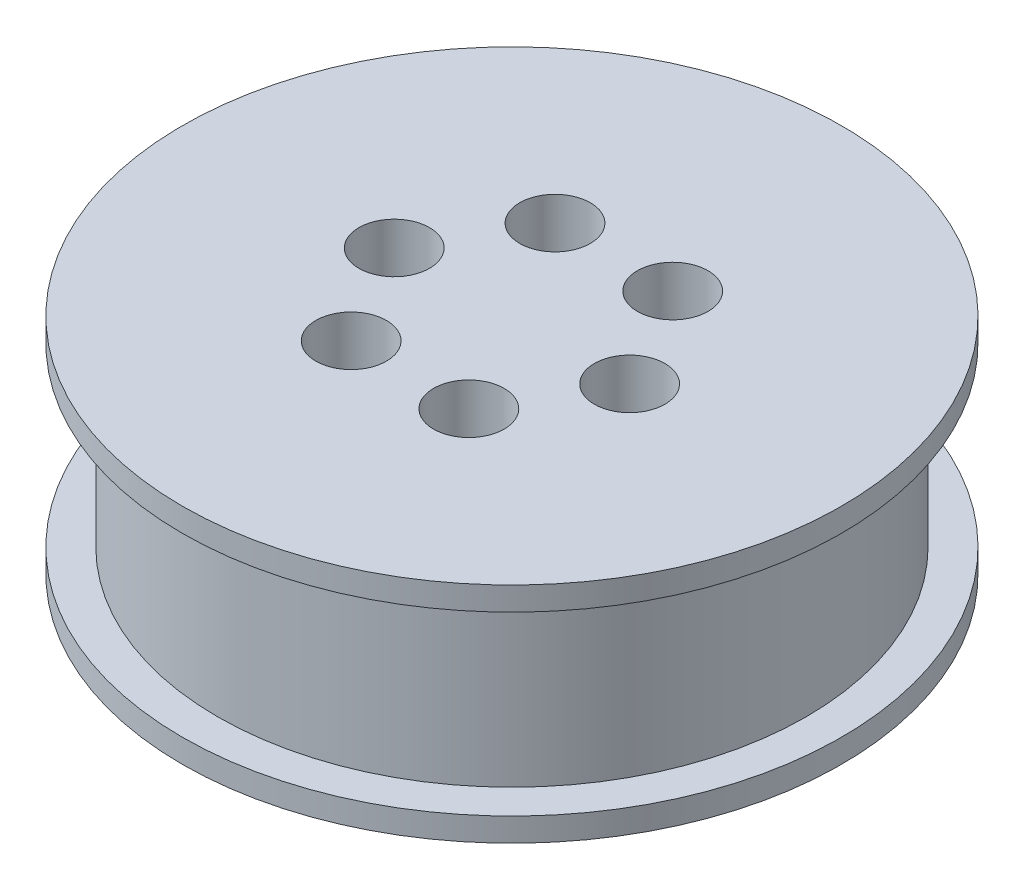
from build123d import *

# Parameters (mm, degrees)
SKETCH1_R           = 25
BOSS_EXTRUDE1_DEPTH = 7.5
SKETCH2_R           = 28
BOSS_EXTRUDE2_DEPTH = 2
SKETCH3_R           = 1.7
CUT_EXTRUDE1_DEPTH  = 44.920382512
SKETCH4_R           = 3
CUT_EXTRUDE2_DEPTH  = 5


with BuildPart() as part:
    # Sketch1 → Boss-Extrude1 (new, symmetric)
    with BuildSketch(Plane(origin=(0, 0, 0), x_dir=(1, 0, 0), z_dir=(0, 1, 0))):
        Circle(SKETCH1_R)
    extrude(amount=BOSS_EXTRUDE1_DEPTH, both=True)

    # Sketch2 → Boss-Extrude2 (add)
    with BuildSketch(Plane(origin=(0, 7.5, 0), x_dir=(1, 0, 0), z_dir=(0, 1, 0))):
        Circle(SKETCH2_R)
    boss_extrude2 = extrude(amount=BOSS_EXTRUDE2_DEPTH)

    # Mirror1: Boss-Extrude2 across plane
    add(boss_extrude2.mirror(Plane.ZX))

    # Sketch3 → Cut-Extrude1 (cut, through all)
    with BuildSketch(Plane(origin=(0, 9.5, 0), x_dir=(1, 0, 0), z_dir=(0, 1, 0))):
        with Locations((10, 0)):
            Circle(SKETCH3_R)
        with Locations((5, -8.660254038)):
            Circle(SKETCH3_R)
        with Locations((-5, -8.660254038)):
            Circle(SKETCH3_R)
        with Locations((-10, 0)):
            Circle(SKETCH3_R)
        with Locations((-5, 8.660254038)):
            Circle(SKETCH3_R)
        with Locations((5, 8.660254038)):
            Circle(SKETCH3_R)
    extrude(amount=-CUT_EXTRUDE1_DEPTH, mode=Mode.SUBTRACT)

    # Sketch4 → Cut-Extrude2 (cut)
    with BuildSketch(Plane(origin=(0, 9.5, 0), x_dir=(1, 0, 0), z_dir=(0, 1, 0))):
        with Locations((5, -8.660254038)):
            Circle(SKETCH4_R)
        with Locations((-5, -8.660254038)):
            Circle(SKETCH4_R)
        with Locations((-10, 0)):
            Circle(SKETCH4_R)
        with Locations((-5, 8.660254038)):
            Circle(SKETCH4_R)
        with Locations((5, 8.660254038)):
            Circle(SKETCH4_R)
        with Locations((10, 0)):
            Circle(SKETCH4_R)
    extrude(amount=-CUT_EXTRUDE2_DEPTH, mode=Mode.SUBTRACT)


solid = part.part
